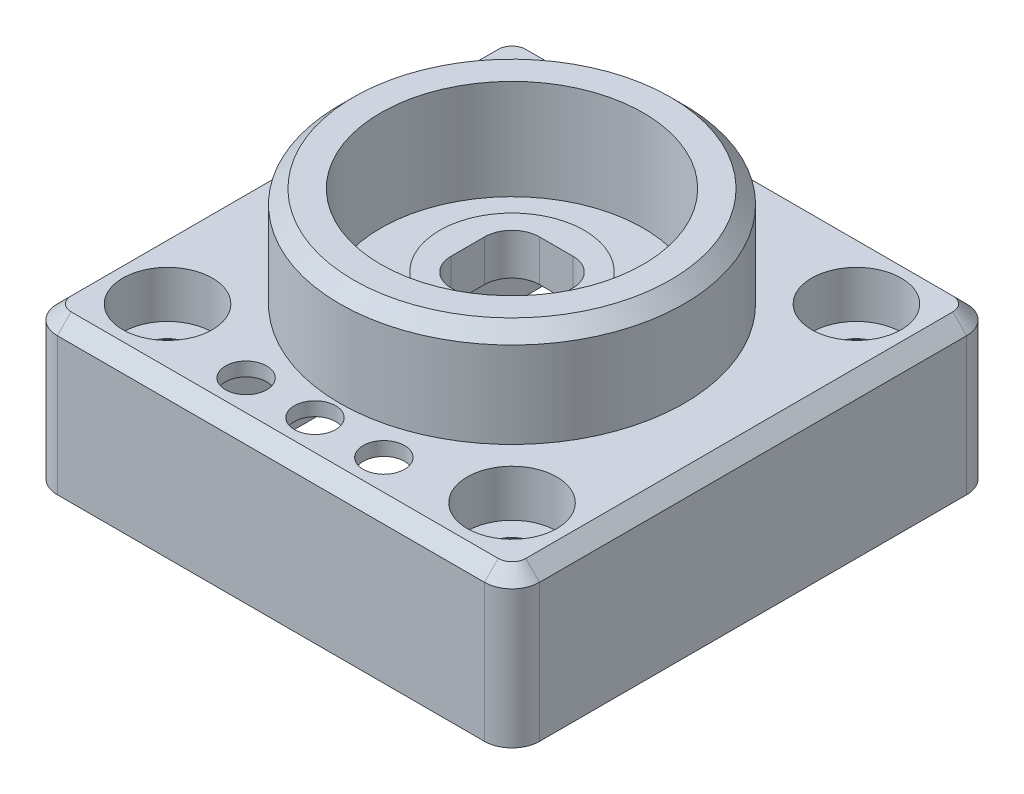
from build123d import *

# Parameters (mm, degrees)
SKETCH_1_R               = 12.5
SKETCH_1_R_2             = 9.53
EXTRUDE_392_DEPTH        = 7.25
EXTRUDE_595_DEPTH        = 11
CUT_EXTRUDE_875_DEPTH    = 10
HOLE_WIZARD_3_AT_2_COUNT = 2
HOLE_WIZARD_3_AT_2_PITCH = 25
HOLE_WIZARD_3_AT_3_COUNT = 2
HOLE_WIZARD_3_AT_3_PITCH = 35.355339059
HOLE_WIZARD_3_AT_4_COUNT = 2
HOLE_WIZARD_3_AT_4_PITCH = 25
HOLE_WIZARD_1963_D       = 3
EXTRUDE_3682_DEPTH       = 1.6
HOLE_WIZARD_M2_D         = 1.6
HOLE_WIZARD_M2_DEPTH     = 2
HOLE_WIZARD_M2_TIP       = 0.480688495
SKETCH_22_R              = 2.6
CUT_EXTRUDE_4947_DEPTH   = 42.970972112
SKETCH_26_R              = 5.25
EXTRUDE_5417_DEPTH       = 2
CUT_EXTRUDE_5653_DEPTH   = 28.955321497
CHAMFER_1_SIZE           = 1
FILLET_1_R               = 4
CUT_EXTRUDE_6973_DEPTH   = 2.5
HOLE_WIZARD_3_2_D        = 2.5
HOLE_WIZARD_3_2_DEPTH    = 7
HOLE_WIZARD_3_2_TIP      = 0.751075774


with BuildPart() as part:
    # Эскиз1 → Extrude 392 (new body)
    with BuildSketch(Plane(origin=(0, 0, 0), x_dir=(1, 0, 0), z_dir=(0, 1, 0))):
        with Locations(Location((0, 0, 0), (0, 0, 270))):
            Circle(SKETCH_1_R)
        with Locations(Location((0, 0, 0), (0, 0, 270))):
            Circle(SKETCH_1_R_2, mode=Mode.SUBTRACT)
    extrude(amount=-EXTRUDE_392_DEPTH)

    # Эскиз8 → Extrude 595 (add)
    with BuildSketch(Plane.XZ.offset(7.25)):
        with BuildLine():
            Line((-15.5, 17.5), (15.5, 17.5))
            ThreePointArc((15.5, 17.5), (16.914213562, 16.914213562), (17.5, 15.5))
            Line((17.5, 15.5), (17.5, -15.5))
            ThreePointArc((17.5, -15.5), (16.914213562, -16.914213562), (15.5, -17.5))
            Line((15.5, -17.5), (-15.5, -17.5))
            ThreePointArc((-15.5, -17.5), (-16.914213562, -16.914213562), (-17.5, -15.5))
            Line((-17.5, -15.5), (-17.5, 15.5))
            ThreePointArc((-17.5, 15.5), (-16.914213562, 16.914213562), (-15.5, 17.5))
        make_face()
    extrude(amount=EXTRUDE_595_DEPTH)

    # Эскиз9 → Cut-Extrude 875 (cut)
    with BuildSketch(Plane.XZ.offset(18.25)):
        with BuildLine():
            Line((-6.5, 16), (6.5, 16))
            ThreePointArc((6.5, 16), (7.914213562, 15.414213562), (8.5, 14))
            Line((8.5, 14), (8.5, -14))
            ThreePointArc((8.5, -14), (7.914213562, -15.414213562), (6.5, -16))
            Line((6.5, -16), (-6.5, -16))
            ThreePointArc((-6.5, -16), (-7.914213562, -15.414213562), (-8.5, -14))
            Line((-8.5, -14), (-8.5, 14))
            ThreePointArc((-8.5, 14), (-7.914213562, 15.414213562), (-6.5, 16))
        make_face()
    extrude(amount=-CUT_EXTRUDE_875_DEPTH, mode=Mode.SUBTRACT)

    # Эскиз10 → Hole Wizard 3 (revolve, cut)
    with BuildSketch(Plane(origin=(-12.5, -7.25, -12.5), x_dir=(0, 0, 1), z_dir=(1, 0, 0))):
        Polygon((0, 0), (0, 11), (1.7, 11), (1.7, 3.425), (1.725, 3.4), (3.25, 3.4), (3.25, 0), align=None)
    hole_wizard_3 = revolve(axis=Axis((-12.5, -0.9, -12.5), (0, -1, 0)), mode=Mode.SUBTRACT)

    # Hole Wizard 3 at 2: Hole Wizard 3 ×2
    with Locations(*[(i * HOLE_WIZARD_3_AT_2_PITCH, 0, 0) for i in range(1, HOLE_WIZARD_3_AT_2_COUNT)]):
        add(hole_wizard_3, mode=Mode.SUBTRACT)

    # Hole Wizard 3 at 3: Hole Wizard 3 ×2
    with Locations(*[Vector(0.7071067811865476, 0, 0.7071067811865476) * (i * HOLE_WIZARD_3_AT_3_PITCH) for i in range(1, HOLE_WIZARD_3_AT_3_COUNT)]):
        add(hole_wizard_3, mode=Mode.SUBTRACT)

    # Hole Wizard 3 at 4: Hole Wizard 3 ×2
    with Locations(*[(0, 0, i * HOLE_WIZARD_3_AT_4_PITCH) for i in range(1, HOLE_WIZARD_3_AT_4_COUNT)]):
        add(hole_wizard_3, mode=Mode.SUBTRACT)

    # Hole Wizard 1963 (through all)
    with Locations(Plane(origin=(0, -7.25, 0), x_dir=(1, 0, 0), z_dir=(0, 1, 0))):
        with Locations((0, -14.3), (-5, -14.3), (5, -14.3)):
            Hole(HOLE_WIZARD_1963_D / 2)

    # Эскиз29 → Extrude 3682 (add)
    with BuildSketch(Plane.XZ.offset(8.25)):
        with BuildLine():
            Line((-6.5, -5), (-8.5, -5))
            Line((-8.5, -5), (-8.5, -8))
            Line((-8.5, -8), (-6.5, -8))
            ThreePointArc((-6.5, -8), (-5, -6.5), (-6.5, -5))
        make_face()
        with BuildLine():
            Line((6.5, -5), (8.5, -5))
            Line((8.5, -5), (8.5, -8))
            Line((8.5, -8), (6.5, -8))
            ThreePointArc((6.5, -8), (5, -6.5), (6.5, -5))
        make_face()
        with BuildLine():
            Line((-6.5, 8), (-8.5, 8))
            Line((-8.5, 8), (-8.5, 5))
            Line((-8.5, 5), (-6.5, 5))
            ThreePointArc((-6.5, 5), (-5, 6.5), (-6.5, 8))
        make_face()
        with BuildLine():
            Line((6.5, 8), (8.5, 8))
            Line((8.5, 8), (8.5, 5))
            Line((8.5, 5), (6.5, 5))
            ThreePointArc((6.5, 5), (5, 6.5), (6.5, 8))
        make_face()
    extrude(amount=EXTRUDE_3682_DEPTH)

    # Крепление платы M2
    with Locations(Plane(origin=(0, -9.85, 0), x_dir=(-1, 0, 0), z_dir=(0, -1, 0))):
        with Locations((6.5, -6.5), (-6.5, -6.5), (6.5, 6.5), (-6.5, 6.5)):
            Hole(HOLE_WIZARD_M2_D / 2, depth=HOLE_WIZARD_M2_DEPTH)
            with Locations((0, 0, -(HOLE_WIZARD_M2_DEPTH + HOLE_WIZARD_M2_TIP / 2))):  # 118° drill point
                Cone(0, HOLE_WIZARD_M2_D / 2, HOLE_WIZARD_M2_TIP, mode=Mode.SUBTRACT)

    # Эскиз22 → Cut-Extrude 4947 (cut, through all)
    with BuildSketch(Plane(origin=(0, 0, -16), x_dir=(-1, 0, 0), z_dir=(0, 0, -1))):
        with Locations((0, -13.95)):
            Circle(SKETCH_22_R)
    extrude(amount=CUT_EXTRUDE_4947_DEPTH, mode=Mode.SUBTRACT)

    # Эскиз26 → Extrude 5417 (add)
    with BuildSketch(Plane(origin=(0, -7.25, 0), x_dir=(1, 0, 0), z_dir=(0, 1, 0))):
        with Locations(Location((0, 0, 0), (0, 0, 90))):
            Circle(SKETCH_26_R)
    extrude(amount=EXTRUDE_5417_DEPTH)

    # Эскиз25 → Cut-Extrude 5653 (cut, through all)
    with BuildSketch(Plane(origin=(0, -5.25, 0), x_dir=(1, 0, 0), z_dir=(0, 1, 0))):
        with BuildLine():
            Line((-1.21, 3.21), (1.21, 3.21))
            ThreePointArc((1.21, 3.21), (2.624213562, 2.624213562), (3.21, 1.21))
            Line((3.21, 1.21), (3.21, -1.21))
            ThreePointArc((3.21, -1.21), (2.624213562, -2.624213562), (1.21, -3.21))
            Line((1.21, -3.21), (-1.21, -3.21))
            ThreePointArc((-1.21, -3.21), (-2.624213562, -2.624213562), (-3.21, -1.21))
            Line((-3.21, -1.21), (-3.21, 1.21))
            ThreePointArc((-3.21, 1.21), (-2.624213562, 2.624213562), (-1.21, 3.21))
        make_face()
    extrude(amount=-CUT_EXTRUDE_5653_DEPTH, mode=Mode.SUBTRACT)

    # Фаска 1
    chamfer_1_edges = [part.edges().sort_by_distance(p)[0] for p in [
        (0, -7.25, -17.5),
        (16.914213562, -7.25, -16.914213562),
        (17.5, -7.25, 0),
        (16.914213562, -7.25, 16.914213562),
        (0, -7.25, 17.5),
        (-16.914213562, -7.25, 16.914213562),
        (-17.5, -7.25, 0),
        (0, 0, -12.5),
        (-16.914213562, -7.25, -16.914213562),
    ]]
    chamfer(chamfer_1_edges, length=CHAMFER_1_SIZE)

    # Скругление1
    # the kernel refuses this fillet: 4 mm, written as the material it adds along each edge
    with BuildSketch(Plane(origin=(8.5, -8.25, -8), x_dir=(0, 0, -1), z_dir=(0, -1, 0)), Plane(origin=(8.5, -8.25, 5), x_dir=(0, 0, -1), z_dir=(0, -1, 0)), Plane(origin=(-8.5, -8.25, 8), x_dir=(0, 0, 1), z_dir=(0, -1, 0)), Plane(origin=(-8.5, -8.25, -5), x_dir=(0, 0, 1), z_dir=(0, -1, 0))) as fillet_1_piece_1:
        with BuildLine():
            CenterArc((3.623475383, -4), FILLET_1_R, 90, 68.676313736)
            Line((-0.102688532, -2.545454545), (-0.475304923, -2.4))
            ThreePointArc((-0.475304923, -2.4), (-0.4, -2), (-0.4, 0))
            Line((-0.4, 0), (0, 0.4))
            Line((0, 0.4), (3.623475383, 0.4))
            Line((3.623475383, 0.4), (3.623475383, 0))
        make_face()
    extrude(amount=1.6)
    with BuildSketch(Plane(origin=(8.5, -8.25, -5), x_dir=(0, 0, 1), z_dir=(0, -1, 0)), Plane(origin=(8.5, -8.25, 8), x_dir=(0, 0, 1), z_dir=(0, -1, 0)), Plane(origin=(-8.5, -8.25, 5), x_dir=(0, 0, -1), z_dir=(0, -1, 0)), Plane(origin=(-8.5, -8.25, -8), x_dir=(0, 0, -1), z_dir=(0, -1, 0))) as fillet_1_piece_2:
        with BuildLine():
            CenterArc((3.623475383, 4), FILLET_1_R, 201.323686264, 68.676313736)
            Line((-0.102688532, 2.545454545), (-0.475304923, 2.4))
            ThreePointArc((-0.475304923, 2.4), (-0.4, 2), (-0.4, 0))
            Line((-0.4, 0), (0, -0.4))
            Line((0, -0.4), (3.623475383, -0.4))
            Line((3.623475383, -0.4), (3.623475383, 0))
        make_face()
    extrude(amount=1.6)

    # Эскиз36 → Cut-Extrude 6973 (cut)
    with BuildSketch(Plane.XZ.offset(18.25)):
        with BuildLine():
            Line((-14, 16), (14, 16))
            ThreePointArc((14, 16), (15.414213562, 15.414213562), (16, 14))
            Line((16, 14), (16, -14))
            ThreePointArc((16, -14), (15.414213562, -15.414213562), (14, -16))
            Line((14, -16), (-14, -16))
            ThreePointArc((-14, -16), (-15.414213562, -15.414213562), (-16, -14))
            Line((-16, -14), (-16, 14))
            ThreePointArc((-16, 14), (-15.414213562, 15.414213562), (-14, 16))
        make_face()
    extrude(amount=-CUT_EXTRUDE_6973_DEPTH, mode=Mode.SUBTRACT)

    # Hole Wizard 3 2
    with Locations(Plane(origin=(0, -15.75, 0), x_dir=(-1, 0, 0), z_dir=(0, -1, 0))):
        with Locations((11.75, 0), (-11.75, 0)):
            Hole(HOLE_WIZARD_3_2_D / 2, depth=HOLE_WIZARD_3_2_DEPTH)
            with Locations((0, 0, -(HOLE_WIZARD_3_2_DEPTH + HOLE_WIZARD_3_2_TIP / 2))):  # 118° drill point
                Cone(0, HOLE_WIZARD_3_2_D / 2, HOLE_WIZARD_3_2_TIP, mode=Mode.SUBTRACT)


solid = part.part
